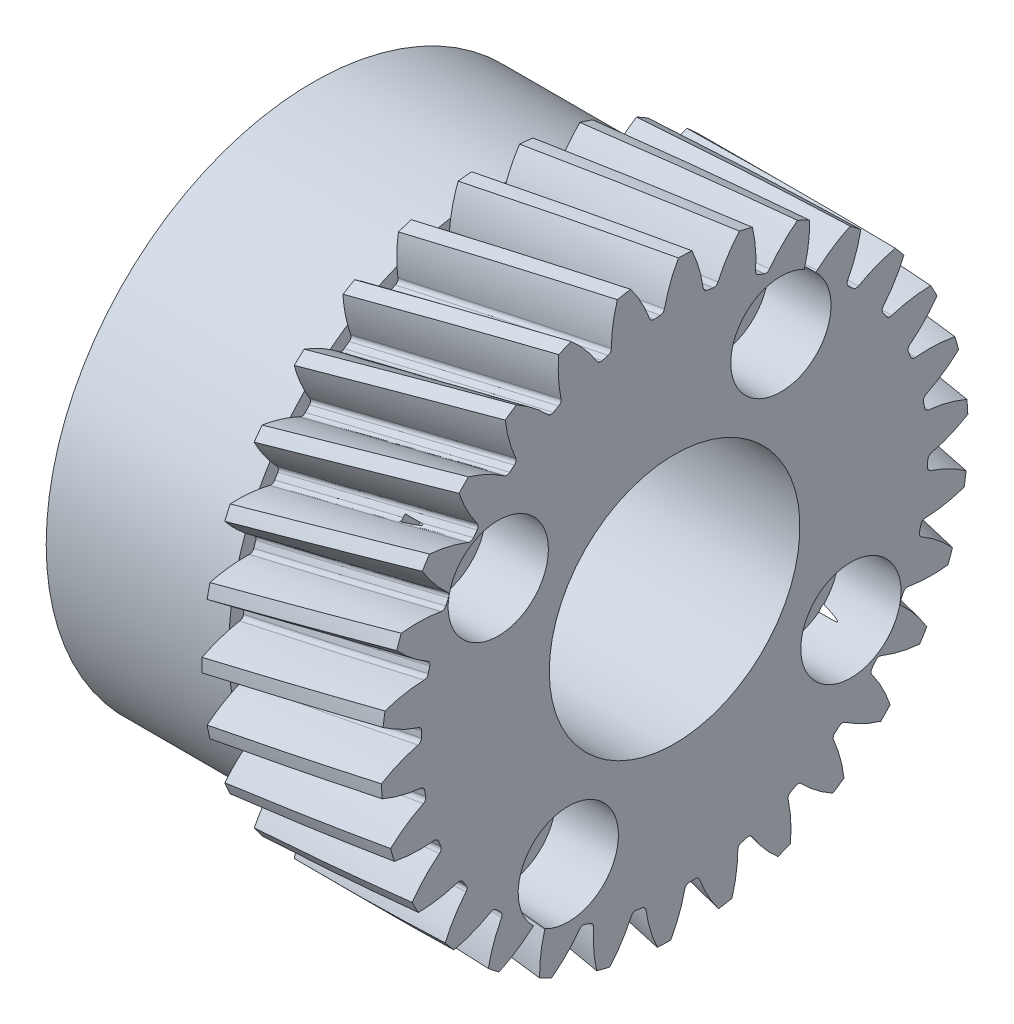
from build123d import *

# Parameters (mm, degrees)
BASPROSKE_W            = 10
BASPROSKE_H            = 16.394561617
TOOTHCUTLH_PITCH       = 446.185627248
TOOTHCUTLH_HEIGHT      = 10
TOOTHCUTLH_RADIUS      = 16.394561617
TOOTHCUTLH_START_ANGLE = -90
TEETHCUTSLH_COUNT      = 30
TEETHCUTSLH_ANGLE      = 348
BORSKE_R               = 2.5
BORE_DEPTH             = 62.5000025
SKETCH3_R              = 1.6
CUT_EXTRUDE1_DEPTH     = 26.250016042
SKETCH5_R              = 7
CUT_EXTRUDE2_DEPTH     = 26.250016042
BOSS_EXTRUDE1_START    = 10.2
SKETCH6_R              = 14.9
SKETCH6_R_2            = 7
SKETCH6_R_3            = 1.6
BOSS_EXTRUDE1_DEPTH    = 10.2
SKETCH7_R              = 2.8
CUT_EXTRUDE3_DEPTH     = 3.5


with BuildPart() as part:
    # BasProSke → Base-Revolve (revolve)
    with BuildSketch(Plane(origin=(0, 0, 0), x_dir=(1, 0, 0), z_dir=(0, 1, 0)), mode=Mode.PRIVATE) as base_revolve_sk:
        with Locations((5, 8.197280809)):
            Rectangle(BASPROSKE_W, BASPROSKE_H)
    revolve(base_revolve_sk.sketch.rotate(Axis((-10, 0, 0), (1, 0, 0)), 180), axis=Axis((-10, 0, 0), (1, 0, 0)))

    # ToothCutLH: sweep along a helix
    with BuildLine() as toothcutlh_path:
        add(Helix(TOOTHCUTLH_PITCH, TOOTHCUTLH_HEIGHT, TOOTHCUTLH_RADIUS, center=(0, 0, 0), direction=(1, 0, 0), lefthand=True, mode=Mode.PRIVATE).rotate(Axis((0, 0, 0), (1, 0, 0)), TOOTHCUTLH_START_ANGLE))
    # TooCutSkeRH<3> → ToothCutLH (sweep, cut)
    with BuildSketch(Plane(origin=(0, 0, 0), x_dir=(0, 0, -1), z_dir=(1, 0, 0))):
        with BuildLine():
            ThreePointArc((0.17133242, 14.143523908), (0, 14.144561617), (-0.17133242, 14.143523908))
            ThreePointArc((-0.17133242, 14.143523908), (-0.32401072, 14.192987543), (-0.415511076, 14.324839731))
            ThreePointArc((-0.415511076, 14.324839731), (-0.925451044, 15.622806112), (-1.666873543, 16.803927687))
            ThreePointArc((-1.666873543, 16.803927687), (0, 16.886398465), (1.666873543, 16.803927687))
            ThreePointArc((1.666873543, 16.803927687), (0.925451044, 15.622806112), (0.415511076, 14.324839731))
            ThreePointArc((0.415511076, 14.324839731), (0.32401072, 14.192987543), (0.17133242, 14.143523908))
        make_face()
    toothcutlh = sweep(path=toothcutlh_path.line, is_frenet=True, mode=Mode.SUBTRACT)

    # TeethCutsLH: ToothCutLH ×30 about axis
    teethcutslh_axis = Axis((-10, 0, 0), (1, 0, 0))
    for i in range(1, TEETHCUTSLH_COUNT):
        add(toothcutlh.rotate(teethcutslh_axis, i * TEETHCUTSLH_ANGLE / (TEETHCUTSLH_COUNT - 1)), mode=Mode.SUBTRACT)

    # BorSke → Bore (cut, symmetric)
    with BuildSketch(Plane(origin=(0, 0, 0), x_dir=(0, 0, -1), z_dir=(1, 0, 0))):
        with Locations(Location((0, 0, 0), (0, 0, 180))):
            Circle(BORSKE_R)
    extrude(amount=BORE_DEPTH, both=True, mode=Mode.SUBTRACT)

    # Sketch3 → Cut-Extrude1 (cut, through all)
    with BuildSketch(Plane.ZY):
        with Locations((-9.848401351, -5.937928159)):
            Circle(SKETCH3_R)
        with Locations((-5.937928159, 9.848401351)):
            Circle(SKETCH3_R)
        with Locations((5.937928159, -9.848401351)):
            Circle(SKETCH3_R)
        with Locations((9.848401351, 5.937928159)):
            Circle(SKETCH3_R)
    extrude(amount=-CUT_EXTRUDE1_DEPTH, mode=Mode.SUBTRACT)

    # Sketch5 → Cut-Extrude2 (cut, through all)
    with BuildSketch(Plane.ZY):
        Circle(SKETCH5_R)
    extrude(amount=-CUT_EXTRUDE2_DEPTH, mode=Mode.SUBTRACT)

    # Sketch6 → Boss-Extrude1 (add)
    with BuildSketch(Plane.ZY.offset(BOSS_EXTRUDE1_START)):
        with Locations(Location((0, 0, 0), (0, 0, 183.682246103))):
            Circle(SKETCH6_R)
        Circle(SKETCH6_R_2, mode=Mode.SUBTRACT)
        with Locations((5.937928159, -9.848401351)):
            Circle(SKETCH6_R_3, mode=Mode.SUBTRACT)
        with Locations((-9.848401351, -5.937928159)):
            Circle(SKETCH6_R_3, mode=Mode.SUBTRACT)
        with Locations((-5.937928159, 9.848401351)):
            Circle(SKETCH6_R_3, mode=Mode.SUBTRACT)
        with Locations((9.848401351, 5.937928159)):
            Circle(SKETCH6_R_3, mode=Mode.SUBTRACT)
    extrude(amount=-BOSS_EXTRUDE1_DEPTH)

    # Sketch7 → Cut-Extrude3 (cut)
    with BuildSketch(Plane(origin=(10, 0, 0), x_dir=(0, 0, -1), z_dir=(1, 0, 0))):
        with Locations((-9.848401351, 5.937928159)):
            Circle(SKETCH7_R)
        with Locations((5.937928159, 9.848401351)):
            Circle(SKETCH7_R)
        with Locations((9.848401351, -5.937928159)):
            Circle(SKETCH7_R)
        with Locations((-5.937928159, -9.848401351)):
            Circle(SKETCH7_R)
    extrude(amount=-CUT_EXTRUDE3_DEPTH, mode=Mode.SUBTRACT)


solid = part.part
